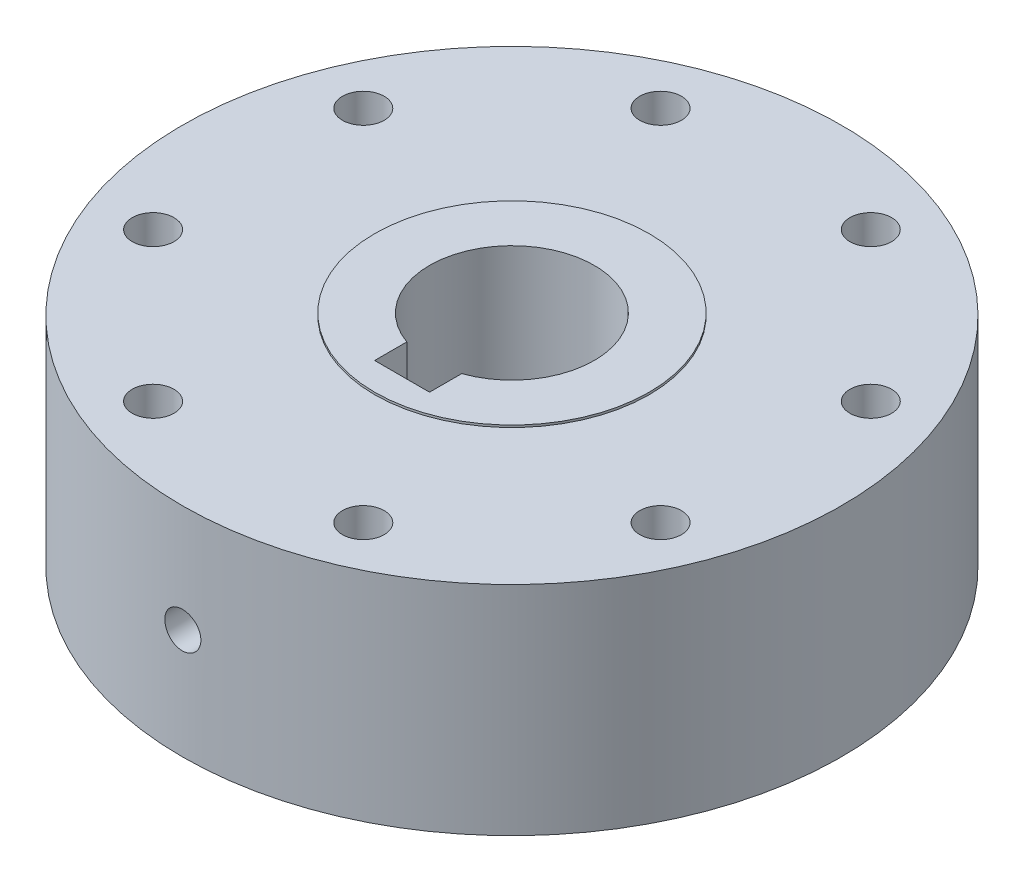
from build123d import *

# Parameters (mm, degrees)
SKETCH1_R              = 38.1
SKETCH1_R_2            = 9.525
BOSS_EXTRUDE1_DEPTH    = 25.4
F_10_32_TAPPED_HOLE1_D = 4.826
CIRPATTERN1_COUNT      = 8
SKETCH4_W              = 6.35
SKETCH4_H              = 6.35
CUT_EXTRUDE1_DEPTH     = 60.56828015
SKETCH5_W              = 2.0828
SKETCH5_H              = 25.4
SKETCH7_OUTSIDE_W      = 100.344
SKETCH7_OUTSIDE_H      = 100.344
SKETCH7_OUTSIDE_R      = 15.875
CUT_EXTRUDE2_DEPTH     = 0.254


with BuildPart() as part:
    # Sketch1 → Boss-Extrude1 (new body)
    with BuildSketch(Plane(origin=(0, 0, 0), x_dir=(1, 0, 0), z_dir=(0, 1, 0))):
        Circle(SKETCH1_R)
        Circle(SKETCH1_R_2, mode=Mode.SUBTRACT)
    extrude(amount=BOSS_EXTRUDE1_DEPTH)

    # #10-32 Tapped Hole1 (through all)
    with Locations(Plane(origin=(0, 25.4, 0), x_dir=(-1, 0, 0), z_dir=(0, 1, 0))):
        with Locations((29.333175157, -12.150198978)):
            f_10_32_tapped_hole1 = Hole(F_10_32_TAPPED_HOLE1_D / 2)

    # CirPattern1: #10-32 Tapped Hole1 ×8 about axis
    cirpattern1_axis = Axis((0, 25.4, 0), (0, -1, 0))
    for i in range(1, CIRPATTERN1_COUNT):
        add(f_10_32_tapped_hole1.rotate(cirpattern1_axis, i * 360 / CIRPATTERN1_COUNT), mode=Mode.SUBTRACT)

    # Sketch4 → Cut-Extrude1 (cut, through all)
    with BuildSketch(Plane(origin=(0, 25.4, 0), x_dir=(1, 0, 0), z_dir=(0, 1, 0))):
        with Locations((0, -9.525)):
            Rectangle(SKETCH4_W, SKETCH4_H)
    extrude(amount=-CUT_EXTRUDE1_DEPTH, mode=Mode.SUBTRACT)

    # Sketch5 → #8-32 Tapped Hole1 (revolve, cut)
    with BuildSketch(Plane(origin=(0, 12.7, 12.7), x_dir=(0, 1, 0), z_dir=(1, 0, 0))):
        with Locations((1.0414, 12.7)):
            Rectangle(SKETCH5_W, SKETCH5_H)
    revolve(axis=Axis((0, 12.7, 6.35), (0, 0, 1)), mode=Mode.SUBTRACT)

    # Sketch7 outside → Cut-Extrude2 (cut)
    with BuildSketch(Plane(origin=(0, 25.4, 0), x_dir=(1, 0, 0), z_dir=(0, 1, 0))):
        Rectangle(SKETCH7_OUTSIDE_W, SKETCH7_OUTSIDE_H)
        Circle(SKETCH7_OUTSIDE_R, mode=Mode.SUBTRACT)
    extrude(amount=-CUT_EXTRUDE2_DEPTH, mode=Mode.SUBTRACT)


solid = part.part
